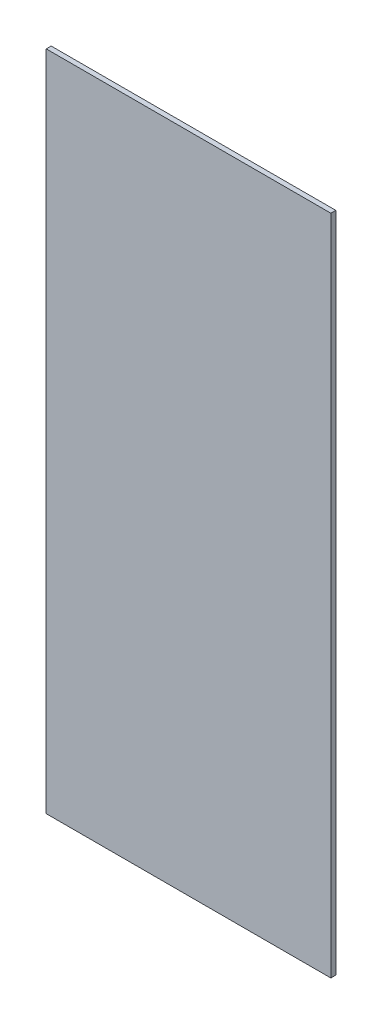
from build123d import *

# Parameters (mm, degrees)
SKETCH1_W           = 575
SKETCH1_H           = 1338
BOSS_EXTRUDE1_DEPTH = 10


with BuildPart() as part:
    # Sketch1 → Boss-Extrude1 (new body)
    with BuildSketch(Plane.XY):
        Rectangle(SKETCH1_W, SKETCH1_H)
    extrude(amount=BOSS_EXTRUDE1_DEPTH)


solid = part.part
